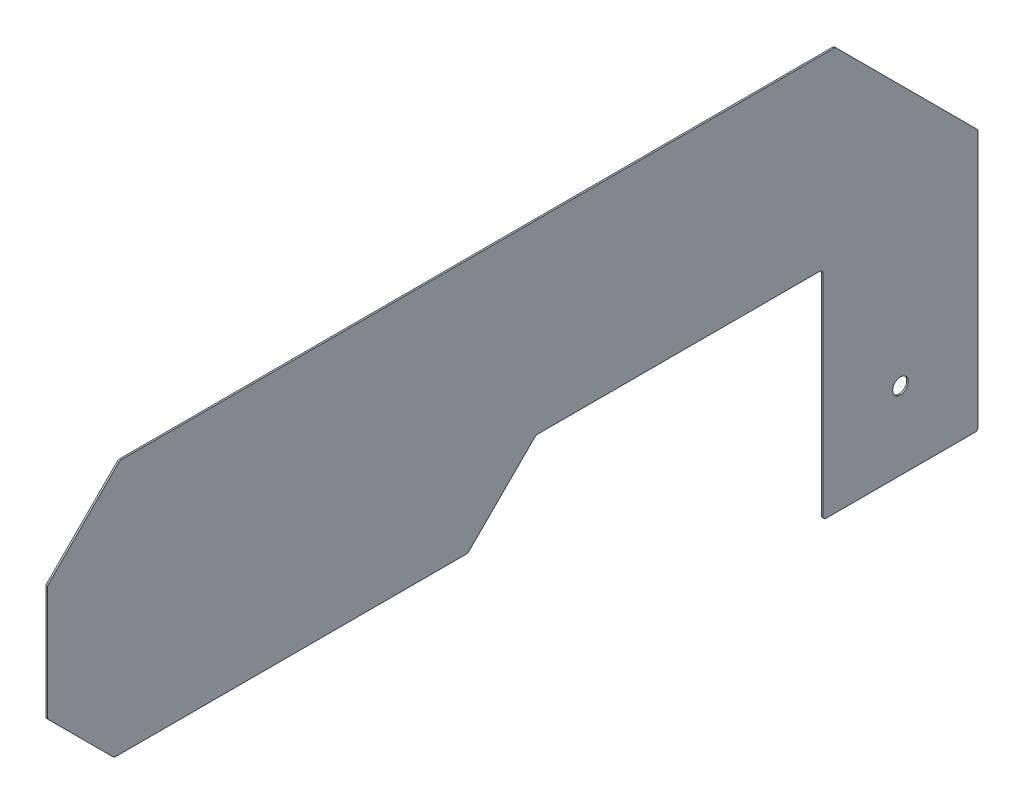
from build123d import *

# Parameters (mm, degrees)
EXTRUDE_1_DEPTH             = 1
FILLET_3_R                  = 2
HOLE_WIZARD_10_0_10_1_D     = 10
HOLE_WIZARD_10_0_10_1_DEPTH = 19.495696905
HOLE_WIZARD_10_0_10_1_TIP   = 3.004303095


with BuildPart() as part:
    # Sketch 2 → Бобышка-Вытянуть1 (new body)
    with BuildSketch(Plane(origin=(0, 0, 0), x_dir=(0, 0, -1), z_dir=(1, 0, 0))):
        Polygon((0, 0), (100, 0), (100, 168), (8, 260), (-453.432759183, 260), (-500, 213.432759183), (-500, 138.9149999), (-457.0850001, 96), (-229, 96), (-185, 140), (0, 140), align=None)
    extrude(amount=EXTRUDE_1_DEPTH)

    # Скругление3
    fillet_3_edges = [part.edges().sort_by_distance(p)[0] for p in [
        (0.5, 213.432759183, 500),
        (0.5, 138.9149999, 500),
        (0.5, 96, 457.0850001),
        (0.5, 96, 229),
        (0.5, 140, 185),
        (0.5, 140, 0),
        (0.5, 0, 0),
        (0.5, 0, -100),
        (0.5, 168, -100),
        (0.5, 260, -8),
        (0.5, 260, 453.432759183),
    ]]
    fillet(fillet_3_edges, radius=FILLET_3_R)

    # Диаметр отверстия Ø10.0 (10)1
    with Locations(Plane(origin=(1, 0, 0), x_dir=(0, 0, -1), z_dir=(1, 0, 0))):
        with Locations((50, 50)):
            Hole(HOLE_WIZARD_10_0_10_1_D / 2, depth=HOLE_WIZARD_10_0_10_1_DEPTH)
            with Locations((0, 0, -(HOLE_WIZARD_10_0_10_1_DEPTH + HOLE_WIZARD_10_0_10_1_TIP / 2))):  # 118° drill point
                Cone(0, HOLE_WIZARD_10_0_10_1_D / 2, HOLE_WIZARD_10_0_10_1_TIP, mode=Mode.SUBTRACT)


solid = part.part
